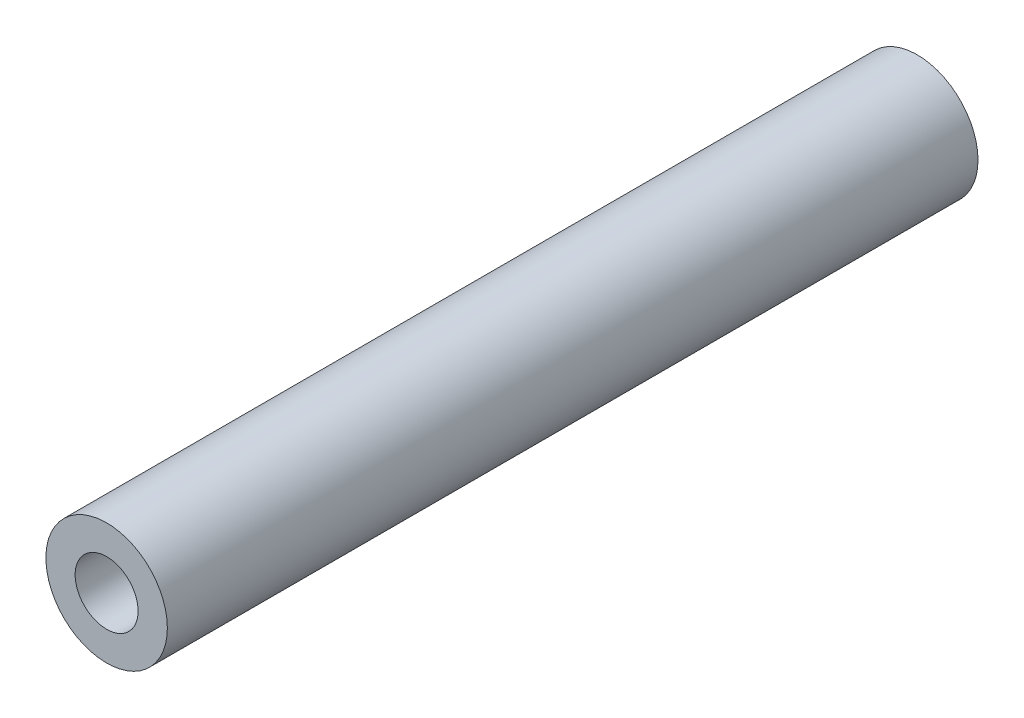
from build123d import *

# Parameters (mm, degrees)
SKETCH1_R                      = 5
BOSS_EXTRUDE1_DEPTH            = 66.73
F_6_0_204_DIAMETER_HOLE1_D     = 5.1816
F_6_0_204_DIAMETER_HOLE1_DEPTH = 30
F_6_0_204_DIAMETER_HOLE1_TIP   = 1.556709692
F_6_0_204_DIAMETER_HOLE2_D     = 5.1816
F_6_0_204_DIAMETER_HOLE2_DEPTH = 30
F_6_0_204_DIAMETER_HOLE2_TIP   = 1.556709692


with BuildPart() as part:
    # Sketch1 → Boss-Extrude1 (new body)
    with BuildSketch(Plane.XY):
        Circle(SKETCH1_R)
    extrude(amount=BOSS_EXTRUDE1_DEPTH)

    # #6 (0.204) Diameter Hole1
    with Locations(Plane(origin=(0, 0, 0), x_dir=(-1, 0, 0), z_dir=(0, 0, -1))):
        with Locations((0, 0)):
            Hole(F_6_0_204_DIAMETER_HOLE1_D / 2, depth=F_6_0_204_DIAMETER_HOLE1_DEPTH)
            with Locations((0, 0, -(F_6_0_204_DIAMETER_HOLE1_DEPTH + F_6_0_204_DIAMETER_HOLE1_TIP / 2))):  # 118° drill point
                Cone(0, F_6_0_204_DIAMETER_HOLE1_D / 2, F_6_0_204_DIAMETER_HOLE1_TIP, mode=Mode.SUBTRACT)

    # #6 (0.204) Diameter Hole2
    with Locations(Plane.XY.offset(66.73)):
        with Locations((0, 0)):
            Hole(F_6_0_204_DIAMETER_HOLE2_D / 2, depth=F_6_0_204_DIAMETER_HOLE2_DEPTH)
            with Locations((0, 0, -(F_6_0_204_DIAMETER_HOLE2_DEPTH + F_6_0_204_DIAMETER_HOLE2_TIP / 2))):  # 118° drill point
                Cone(0, F_6_0_204_DIAMETER_HOLE2_D / 2, F_6_0_204_DIAMETER_HOLE2_TIP, mode=Mode.SUBTRACT)


solid = part.part
